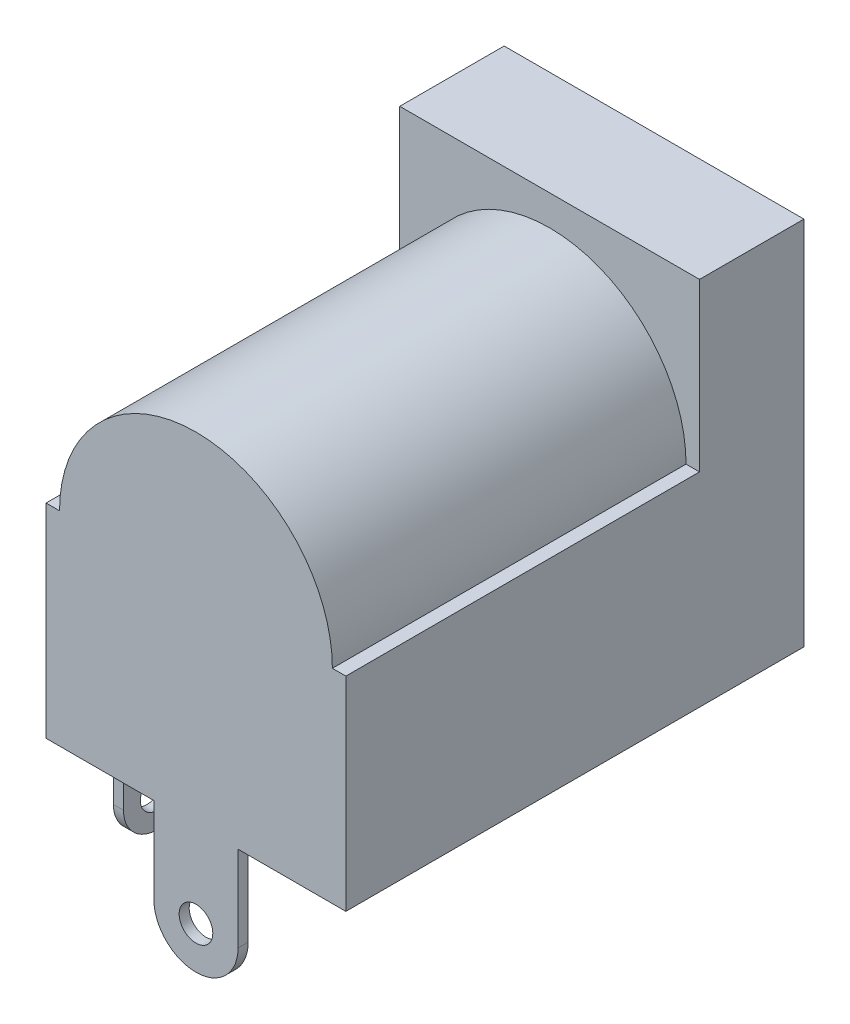
from build123d import *

# Parameters (mm, degrees)
ESBO_O1_W                = 8.9
ESBO_O1_H                = 11
RESSALTO_EXTRUS_O1_DEPTH = 13.6
CORTE_EXTRUS_O1_DEPTH    = 10.5
ESBO_O3_R                = 3.15
CORTE_EXTRUS_O2_DEPTH    = 9.5
ESBO_O4_R                = 1.25
RESSALTO_EXTRUS_O2_DEPTH = 8
FILETE1_SIZE             = 0.5
FILETE1_SIZE_2           = 1
ESBO_O5_W                = 2.5
ESBO_O5_H                = 0.3
RESSALTO_EXTRUS_O3_DEPTH = 3.8
CORTE_EXTRUS_O3_DEPTH    = 10
ESBO_O8_R                = 0.5
CORTE_EXTRUS_O4_DEPTH    = 10
RESSALTO_EXTRUS_O4_DEPTH = 0.3
ESBO_O10_R               = 0.5
CORTE_EXTRUS_O5_DEPTH    = 0.3


with BuildPart() as part:
    # Esboço1 → Ressalto-extrusão1 (new body)
    with BuildSketch(Plane.XY):
        Rectangle(ESBO_O1_W, ESBO_O1_H)
    extrude(amount=RESSALTO_EXTRUS_O1_DEPTH)

    # Esboço2 → Corte-extrusão1 (cut)
    with BuildSketch(Plane.XY.offset(13.6)):
        with BuildLine():
            Line((-4.45, 0.55), (-4.45, 5.5))
            Line((-4.45, 5.5), (4.45, 5.5))
            Line((4.45, 5.5), (4.45, 0.55))
            Line((4.45, 0.55), (4.05, 0.55))
            ThreePointArc((4.05, 0.55), (0, 4.6), (-4.05, 0.55))
            Line((-4.05, 0.55), (-4.45, 0.55))
        make_face()
    extrude(amount=-CORTE_EXTRUS_O1_DEPTH, mode=Mode.SUBTRACT)

    # Esboço3 → Corte-extrusão2 (cut)
    with BuildSketch(Plane(origin=(0, 0, 0), x_dir=(-1, 0, 0), z_dir=(0, 0, -1))):
        with Locations((0, 1)):
            Circle(ESBO_O3_R)
    extrude(amount=-CORTE_EXTRUS_O2_DEPTH, mode=Mode.SUBTRACT)

    # Esboço4 → Ressalto-extrusão2 (add)
    with BuildSketch(Plane(origin=(0, 0, 9.5), x_dir=(-1, 0, 0), z_dir=(0, 0, -1))):
        with Locations((0, 1)):
            Circle(ESBO_O4_R)
    extrude(amount=RESSALTO_EXTRUS_O2_DEPTH)

    # Filete1
    # an asymmetric fillet: 1, 0.5 mm, written as the material it takes off along each edge
    with BuildSketch(Plane(origin=(0, 1, 1.5), x_dir=(-1, 0, 0), z_dir=(0, -1, 0))) as filete1_piece_1:
        with BuildLine():
            Bezier((1.25, -FILETE1_SIZE), (1.25, 0), (1.25 - FILETE1_SIZE_2, 0), weights=[1, 0.707106781, 1])
            Line((1.25 - FILETE1_SIZE_2, 0), (1.25, 0))
            Line((1.25, 0), (1.25, -FILETE1_SIZE))
        make_face()
    revolve(axis=Axis((0, 1, 1.5), (0, 0, -1)), mode=Mode.SUBTRACT)

    # Esboço5 → Ressalto-extrusão3 (add)
    with BuildSketch(Plane.XZ.offset(5.5)):
        with Locations((0, 13.45)):
            Rectangle(ESBO_O5_W, ESBO_O5_H)
        with Locations((0, 7.15)):
            Rectangle(ESBO_O5_W, ESBO_O5_H)
    extrude(amount=RESSALTO_EXTRUS_O3_DEPTH)

    # Esboço7 → Corte-extrusão3 (cut)
    with BuildSketch(Plane.XY.offset(13.6)):
        with BuildLine():
            Line((-1.25, -8.04), (-1.25, -9.3))
            Line((-1.25, -9.3), (1.25, -9.3))
            Line((1.25, -9.3), (1.25, -8.04))
            ThreePointArc((1.25, -8.04), (0, -9.29), (-1.25, -8.04))
        make_face()
    extrude(amount=-CORTE_EXTRUS_O3_DEPTH, mode=Mode.SUBTRACT)

    # Esboço8 → Corte-extrusão4 (cut)
    with BuildSketch(Plane.XY.offset(13.6)):
        with Locations((0, -8.04)):
            Circle(ESBO_O8_R)
    extrude(amount=-CORTE_EXTRUS_O4_DEPTH, mode=Mode.SUBTRACT)

    # Esboço9 → Ressalto-extrusão4 (add)
    with BuildSketch(Plane.ZY.offset(4.45)):
        with BuildLine():
            Line((9.3, -1.5), (11.3, -1.5))
            Line((11.3, -1.5), (11.3, -8.5))
            ThreePointArc((11.3, -8.5), (10.3, -9.5), (9.3, -8.5))
            Line((9.3, -8.5), (9.3, -1.5))
        make_face()
    extrude(amount=RESSALTO_EXTRUS_O4_DEPTH)

    # Esboço10 → Corte-extrusão5 (cut)
    with BuildSketch(Plane.ZY.offset(4.75)):
        with Locations(Location((10.3, -8.5, 0), (0, 0, 270))):
            Circle(ESBO_O10_R)
    extrude(amount=-CORTE_EXTRUS_O5_DEPTH, mode=Mode.SUBTRACT)


solid = part.part
